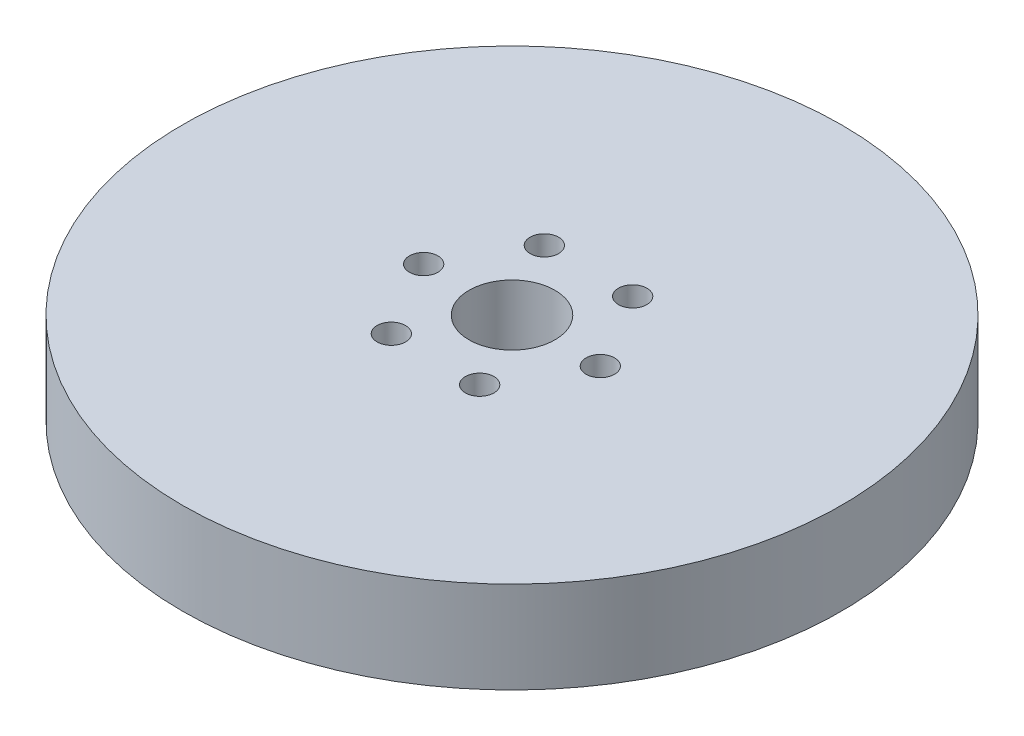
from build123d import *

# Parameters (mm, degrees)
SKETCH1_R           = 57.5
BOSS_EXTRUDE1_DEPTH = 16
SKETCH2_R           = 7.5
CUT_EXTRUDE1_DEPTH  = 83.876414015
SKETCH3_R           = 2.487060287
CUT_EXTRUDE2_DEPTH  = 13.761497294
CIRPATTERN1_COUNT   = 6


with BuildPart() as part:
    # Sketch1 → Boss-Extrude1 (new body)
    with BuildSketch(Plane(origin=(0, 0, 0), x_dir=(1, 0, 0), z_dir=(0, 1, 0))):
        Circle(SKETCH1_R)
    extrude(amount=BOSS_EXTRUDE1_DEPTH)

    # Sketch2 → Cut-Extrude1 (cut, through all)
    with BuildSketch(Plane(origin=(0, 0, 0), x_dir=(1, 0, 0), z_dir=(0, 1, 0))):
        Circle(SKETCH2_R)
    extrude(amount=CUT_EXTRUDE1_DEPTH, mode=Mode.SUBTRACT)

    # Sketch3 → Cut-Extrude2 (cut)
    with BuildSketch(Plane(origin=(0, 16, 0), x_dir=(1, 0, 0), z_dir=(0, 1, 0))):
        with Locations((-15.412001153, 0)):
            Circle(SKETCH3_R)
    cut_extrude2 = extrude(amount=-CUT_EXTRUDE2_DEPTH, mode=Mode.SUBTRACT)

    # CirPattern1: Cut-Extrude2 ×6 about axis
    cirpattern1_axis = Axis((0, 0, 0), (0, 1, 0))
    for i in range(1, CIRPATTERN1_COUNT):
        add(cut_extrude2.rotate(cirpattern1_axis, i * 360 / CIRPATTERN1_COUNT), mode=Mode.SUBTRACT)


solid = part.part
